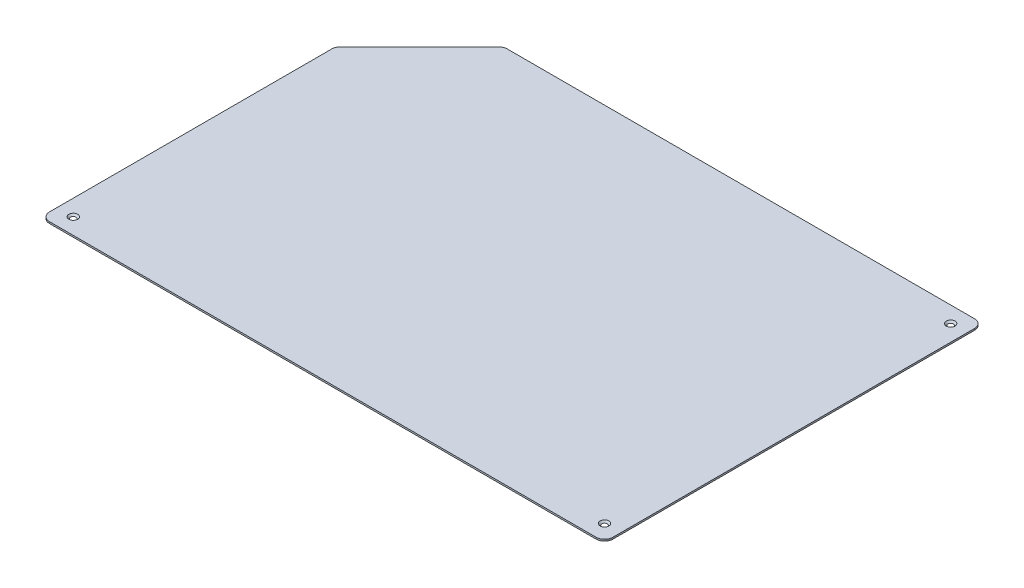
from build123d import *

# Parameters (mm, degrees)
SKETCH1_W                                      = 70
SKETCH1_H                                      = 450.00000000000006
SKETCH1_W_2                                    = 600
BOSS_EXTRUDE1_DEPTH                            = 2
CUT_EXTRUDE1_DEPTH                             = 1.5
TAP_DRILL_FOR_M5X0_8_TAP2_D                    = 4.2
CUT_EXTRUDE2_START                             = -20
CUT_EXTRUDE2_DEPTH                             = 410
BOSS_EXTRUDE2_START                            = -1.500004
BOSS_EXTRUDE2_DEPTH                            = 1.500004
CUT_EXTRUDE3_REACH                             = 624.117
SKETCH13_W                                     = 3.999999999999943
SKETCH13_H                                     = 1.5
CUT_EXTRUDE4_START                             = -1.500012
CUT_EXTRUDE4_DEPTH                             = 1.500012
FILLET1_R                                      = 10
CUT_EXTRUDE5_DEPTH                             = 434.0461869135901
FILLET2_R                                      = 10
CSK_FOR_M5_FLAT_HEAD_MACHINE_SCREW1_AT_2_COUNT = 2
CSK_FOR_M5_FLAT_HEAD_MACHINE_SCREW1_AT_2_PITCH = 411.61522368914996
CSK_FOR_M5_FLAT_HEAD_MACHINE_SCREW1_AT_3_COUNT = 2
CSK_FOR_M5_FLAT_HEAD_MACHINE_SCREW1_AT_3_PITCH = 753.8997832394989


with BuildPart() as part:
    # Sketch1 → Boss-Extrude1 (new body)
    with BuildSketch(Plane(origin=(0, 0, 0), x_dir=(1, 0, 0), z_dir=(0, 1, 0))):
        with Locations((-335, 0)):
            Rectangle(SKETCH1_W, SKETCH1_H)
        Rectangle(SKETCH1_W_2, SKETCH1_H)
    extrude(amount=BOSS_EXTRUDE1_DEPTH)

    # Sketch6 → Cut-Extrude1 (cut)
    with BuildSketch(Plane(origin=(0, 2, 0), x_dir=(1, 0, 0), z_dir=(0, 1, 0))):
        with BuildLine():
            Line((-341.0606607198741, 198.88908788608498), (-332.72792341334934, 190.55635017763316))
            ThreePointArc((-332.72792341334934, 190.55635017763316), (-314.6907946153867, 184.41974360061323), (-298.8274716885969, 194.97203914593416))
            ThreePointArc((-298.8274716885969, 194.97203914593416), (-290.8614378179462, 202.90529640578592), (-280, 205.8076118445749))
            Line((-280, 205.8076118445749), (-280, 201.80761184457492))
            ThreePointArc((-280, 201.80761184457492), (-288.8662005611003, 199.43844938163073), (-295.368880515407, 192.9625250014872))
            ThreePointArc((-295.368880515407, 192.9625250014872), (-314.17414071780195, 180.4532503445859), (-335.5563506063097, 187.7279231211012))
            Line((-335.5563506063097, 187.7279231211012), (-343.8890879128344, 196.06066082955292))
            ThreePointArc((-343.8890879128344, 196.06066082955292), (-343.8890878446203, 198.88908795429913), (-341.0606607198741, 198.88908788608498))
        make_face()
    extrude(amount=-CUT_EXTRUDE1_DEPTH, mode=Mode.SUBTRACT)

    # Tap Drill for M5x0.8 Tap2 (through all)
    with Locations(Plane(origin=(-350.807611845, 2, 205.807611845), x_dir=(0, 0, 1), z_dir=(0, 1, 0))):
        with Locations((0, 0), (-411.61522369, 0), (-411.615222525, 33.33094967), (-378.284274463, 0), (-411.61522369, 631.61522369), (0, 631.61522369)):
            Hole(TAP_DRILL_FOR_M5X0_8_TAP2_D / 2)

    # Sketch11 → Cut-Extrude2 (cut)
    with BuildSketch(Plane.XY.offset(225.00000000000003).offset(CUT_EXTRUDE2_START)):
        with BuildLine():
            Line((-280, 2), (-280, 1.4999999999999996))
            ThreePointArc((-280, 1.4999999999999996), (-279, 0.4999999999999998), (-278, 1.5))
            Line((-278, 1.5), (-278, 2))
            Line((-278, 2), (-280, 2))
        make_face()
        with BuildLine():
            Line((-270, 2), (-270, 1.4999999999999996))
            ThreePointArc((-270, 1.4999999999999996), (-269, 0.4999999999999998), (-268, 1.5))
            Line((-268, 1.5), (-268, 2))
            Line((-268, 2), (-270, 2))
        make_face()
        with BuildLine():
            Line((-260, 2), (-260, 1.4999999999999996))
            ThreePointArc((-260, 1.4999999999999996), (-259, 0.4999999999999998), (-258, 1.5))
            Line((-258, 1.5), (-258, 2))
            Line((-258, 2), (-260, 2))
        make_face()
        with BuildLine():
            Line((-250, 2), (-250, 1.4999999999999996))
            ThreePointArc((-250, 1.4999999999999996), (-249, 0.4999999999999998), (-248, 1.5))
            Line((-248, 1.5), (-248, 2))
            Line((-248, 2), (-250, 2))
        make_face()
        with BuildLine():
            Line((-240, 2), (-240, 1.4999999999999996))
            ThreePointArc((-240, 1.4999999999999996), (-239, 0.4999999999999998), (-238, 1.5))
            Line((-238, 1.5), (-238, 2))
            Line((-238, 2), (-240, 2))
        make_face()
        with BuildLine():
            Line((-229.99999999999997, 2), (-229.99999999999997, 1.4999999999999996))
            ThreePointArc((-229.99999999999997, 1.4999999999999996), (-228.99999999999997, 0.4999999999999998), (-227.99999999999997, 1.5))
            Line((-227.99999999999997, 1.5), (-227.99999999999997, 2))
            Line((-227.99999999999997, 2), (-229.99999999999997, 2))
        make_face()
        with BuildLine():
            Line((-219.99999999999997, 2), (-219.99999999999997, 1.4999999999999996))
            ThreePointArc((-219.99999999999997, 1.4999999999999996), (-218.99999999999997, 0.4999999999999998), (-217.99999999999997, 1.5))
            Line((-217.99999999999997, 1.5), (-217.99999999999997, 2))
            Line((-217.99999999999997, 2), (-219.99999999999997, 2))
        make_face()
        with BuildLine():
            Line((-209.99999999999997, 2), (-209.99999999999997, 1.4999999999999996))
            ThreePointArc((-209.99999999999997, 1.4999999999999996), (-208.99999999999997, 0.4999999999999998), (-207.99999999999997, 1.5))
            Line((-207.99999999999997, 1.5), (-207.99999999999997, 2))
            Line((-207.99999999999997, 2), (-209.99999999999997, 2))
        make_face()
        with BuildLine():
            Line((-199.99999999999994, 2), (-199.99999999999994, 1.4999999999999996))
            ThreePointArc((-199.99999999999994, 1.4999999999999996), (-198.99999999999994, 0.4999999999999998), (-197.99999999999994, 1.5))
            Line((-197.99999999999994, 1.5), (-197.99999999999994, 2))
            Line((-197.99999999999994, 2), (-199.99999999999994, 2))
        make_face()
        with BuildLine():
            Line((-189.99999999999994, 2), (-189.99999999999994, 1.4999999999999996))
            ThreePointArc((-189.99999999999994, 1.4999999999999996), (-188.99999999999994, 0.4999999999999998), (-187.99999999999994, 1.5))
            Line((-187.99999999999994, 1.5), (-187.99999999999994, 2))
            Line((-187.99999999999994, 2), (-189.99999999999994, 2))
        make_face()
        with BuildLine():
            Line((-179.99999999999994, 2), (-179.99999999999994, 1.4999999999999996))
            ThreePointArc((-179.99999999999994, 1.4999999999999996), (-178.99999999999994, 0.4999999999999998), (-177.99999999999994, 1.5))
            Line((-177.99999999999994, 1.5), (-177.99999999999994, 2))
            Line((-177.99999999999994, 2), (-179.99999999999994, 2))
        make_face()
        with BuildLine():
            Line((-169.99999999999994, 2), (-169.99999999999994, 1.4999999999999996))
            ThreePointArc((-169.99999999999994, 1.4999999999999996), (-168.99999999999991, 0.49999999999997136), (-167.99999999999991, 1.5))
            Line((-167.99999999999991, 1.5), (-167.99999999999991, 2))
            Line((-167.99999999999991, 2), (-169.99999999999994, 2))
        make_face()
        with BuildLine():
            Line((-159.99999999999991, 2), (-159.99999999999991, 1.4999999999999996))
            ThreePointArc((-159.99999999999991, 1.4999999999999996), (-158.99999999999991, 0.4999999999999998), (-157.99999999999991, 1.5))
            Line((-157.99999999999991, 1.5), (-157.99999999999991, 2))
            Line((-157.99999999999991, 2), (-159.99999999999991, 2))
        make_face()
        with BuildLine():
            Line((-149.99999999999991, 2), (-149.99999999999991, 1.4999999999999996))
            ThreePointArc((-149.99999999999991, 1.4999999999999996), (-148.99999999999991, 0.4999999999999998), (-147.99999999999991, 1.5))
            Line((-147.99999999999991, 1.5), (-147.99999999999991, 2))
            Line((-147.99999999999991, 2), (-149.99999999999991, 2))
        make_face()
        with BuildLine():
            Line((-139.99999999999991, 2), (-139.99999999999991, 1.4999999999999996))
            ThreePointArc((-139.99999999999991, 1.4999999999999996), (-138.99999999999991, 0.4999999999999998), (-137.9999999999999, 1.5))
            Line((-137.9999999999999, 1.5), (-137.9999999999999, 2))
            Line((-137.9999999999999, 2), (-139.99999999999991, 2))
        make_face()
        with BuildLine():
            Line((-129.9999999999999, 2), (-129.9999999999999, 1.4999999999999996))
            ThreePointArc((-129.9999999999999, 1.4999999999999996), (-128.9999999999999, 0.4999999999999998), (-127.99999999999989, 1.5))
            Line((-127.99999999999989, 1.5), (-127.99999999999989, 2))
            Line((-127.99999999999989, 2), (-129.9999999999999, 2))
        make_face()
        with BuildLine():
            Line((-119.99999999999989, 2), (-119.99999999999989, 1.4999999999999996))
            ThreePointArc((-119.99999999999989, 1.4999999999999996), (-118.99999999999989, 0.4999999999999998), (-117.99999999999989, 1.5))
            Line((-117.99999999999989, 1.5), (-117.99999999999989, 2))
            Line((-117.99999999999989, 2), (-119.99999999999989, 2))
        make_face()
        with BuildLine():
            Line((-109.99999999999987, 2), (-109.99999999999987, 1.4999999999999996))
            ThreePointArc((-109.99999999999987, 1.4999999999999996), (-108.99999999999987, 0.4999999999999998), (-107.99999999999987, 1.5))
            Line((-107.99999999999987, 1.5), (-107.99999999999987, 2))
            Line((-107.99999999999987, 2), (-109.99999999999987, 2))
        make_face()
        with BuildLine():
            Line((-99.99999999999987, 2), (-99.99999999999987, 1.4999999999999996))
            ThreePointArc((-99.99999999999987, 1.4999999999999996), (-98.99999999999987, 0.4999999999999998), (-97.99999999999986, 1.5))
            Line((-97.99999999999986, 1.5), (-97.99999999999986, 2))
            Line((-97.99999999999986, 2), (-99.99999999999987, 2))
        make_face()
        with BuildLine():
            Line((-89.99999999999986, 2), (-89.99999999999986, 1.4999999999999996))
            ThreePointArc((-89.99999999999986, 1.4999999999999996), (-88.99999999999986, 0.4999999999999998), (-87.99999999999986, 1.5))
            Line((-87.99999999999986, 1.5), (-87.99999999999986, 2))
            Line((-87.99999999999986, 2), (-89.99999999999986, 2))
        make_face()
        with BuildLine():
            Line((-79.99999999999984, 2), (-79.99999999999984, 1.4999999999999996))
            ThreePointArc((-79.99999999999984, 1.4999999999999996), (-78.99999999999984, 0.4999999999999998), (-77.99999999999984, 1.5))
            Line((-77.99999999999984, 1.5), (-77.99999999999984, 2))
            Line((-77.99999999999984, 2), (-79.99999999999984, 2))
        make_face()
        with BuildLine():
            Line((-69.99999999999984, 2), (-69.99999999999984, 1.4999999999999996))
            ThreePointArc((-69.99999999999984, 1.4999999999999996), (-68.99999999999984, 0.4999999999999998), (-67.99999999999984, 1.5))
            Line((-67.99999999999984, 1.5), (-67.99999999999984, 2))
            Line((-67.99999999999984, 2), (-69.99999999999984, 2))
        make_face()
        with BuildLine():
            Line((-59.99999999999983, 2), (-59.99999999999983, 1.4999999999999996))
            ThreePointArc((-59.99999999999983, 1.4999999999999996), (-58.99999999999983, 0.4999999999999998), (-57.99999999999983, 1.5))
            Line((-57.99999999999983, 1.5), (-57.99999999999983, 2))
            Line((-57.99999999999983, 2), (-59.99999999999983, 2))
        make_face()
        with BuildLine():
            Line((-49.99999999999982, 2), (-49.99999999999982, 1.4999999999999996))
            ThreePointArc((-49.99999999999982, 1.4999999999999996), (-48.99999999999982, 0.4999999999999998), (-47.99999999999982, 1.5))
            Line((-47.99999999999982, 1.5), (-47.99999999999982, 2))
            Line((-47.99999999999982, 2), (-49.99999999999982, 2))
        make_face()
        with BuildLine():
            Line((-39.999999999999815, 2), (-39.999999999999815, 1.4999999999999996))
            ThreePointArc((-39.999999999999815, 1.4999999999999996), (-38.999999999999815, 0.4999999999999998), (-37.999999999999815, 1.5))
            Line((-37.999999999999815, 1.5), (-37.999999999999815, 2))
            Line((-37.999999999999815, 2), (-39.999999999999815, 2))
        make_face()
        with BuildLine():
            Line((-29.999999999999805, 2), (-29.999999999999805, 1.4999999999999996))
            ThreePointArc((-29.999999999999805, 1.4999999999999996), (-28.999999999999805, 0.4999999999999998), (-27.9999999999998, 1.5))
            Line((-27.9999999999998, 1.5), (-27.9999999999998, 2))
            Line((-27.9999999999998, 2), (-29.999999999999805, 2))
        make_face()
        with BuildLine():
            Line((-19.999999999999794, 2), (-19.999999999999794, 1.4999999999999996))
            ThreePointArc((-19.999999999999794, 1.4999999999999996), (-18.999999999999794, 0.4999999999999998), (-17.999999999999794, 1.5))
            Line((-17.999999999999794, 1.5), (-17.999999999999794, 2))
            Line((-17.999999999999794, 2), (-19.999999999999794, 2))
        make_face()
        with BuildLine():
            Line((-9.999999999999787, 2), (-9.999999999999787, 1.4999999999999996))
            ThreePointArc((-9.999999999999787, 1.4999999999999996), (-8.999999999999787, 0.4999999999999998), (-7.999999999999785, 1.5))
            Line((-7.999999999999785, 1.5), (-7.999999999999785, 2))
            Line((-7.999999999999785, 2), (-9.999999999999787, 2))
        make_face()
        with BuildLine():
            Line((2.2204e-13, 2), (2.2204e-13, 1.4999999999999996))
            ThreePointArc((2.2204e-13, 1.4999999999999996), (1.000000000000223, 0.4999999999999989), (2.000000000000224, 1.5))
            Line((2.000000000000224, 1.5), (2.000000000000224, 2))
            Line((2.000000000000224, 2), (2.2204e-13, 2))
        make_face()
        with BuildLine():
            Line((10.000000000000231, 2), (10.000000000000231, 1.4999999999999996))
            ThreePointArc((10.000000000000231, 1.4999999999999996), (11.000000000000231, 0.4999999999999998), (12.000000000000233, 1.5))
            Line((12.000000000000233, 1.5), (12.000000000000233, 2))
            Line((12.000000000000233, 2), (10.000000000000231, 2))
        make_face()
        with BuildLine():
            Line((20.00000000000024, 2), (20.00000000000024, 1.4999999999999996))
            ThreePointArc((20.00000000000024, 1.4999999999999996), (21.00000000000024, 0.4999999999999998), (22.00000000000024, 1.5))
            Line((22.00000000000024, 1.5), (22.00000000000024, 2))
            Line((22.00000000000024, 2), (20.00000000000024, 2))
        make_face()
        with BuildLine():
            Line((30.00000000000025, 2), (30.00000000000025, 1.4999999999999996))
            ThreePointArc((30.00000000000025, 1.4999999999999996), (31.00000000000025, 0.4999999999999998), (32.00000000000025, 1.5))
            Line((32.00000000000025, 1.5), (32.00000000000025, 2))
            Line((32.00000000000025, 2), (30.00000000000025, 2))
        make_face()
        with BuildLine():
            Line((40.000000000000256, 2), (40.000000000000256, 1.4999999999999996))
            ThreePointArc((40.000000000000256, 1.4999999999999996), (41.000000000000256, 0.4999999999999998), (42.000000000000256, 1.5))
            Line((42.000000000000256, 1.5), (42.000000000000256, 2))
            Line((42.000000000000256, 2), (40.000000000000256, 2))
        make_face()
        with BuildLine():
            Line((50.00000000000027, 2), (50.00000000000027, 1.4999999999999996))
            ThreePointArc((50.00000000000027, 1.4999999999999996), (51.00000000000027, 0.4999999999999998), (52.00000000000027, 1.5))
            Line((52.00000000000027, 1.5), (52.00000000000027, 2))
            Line((52.00000000000027, 2), (50.00000000000027, 2))
        make_face()
        with BuildLine():
            Line((60.00000000000028, 2), (60.00000000000028, 1.4999999999999996))
            ThreePointArc((60.00000000000028, 1.4999999999999996), (61.00000000000028, 0.4999999999999998), (62.00000000000028, 1.5))
            Line((62.00000000000028, 1.5), (62.00000000000028, 2))
            Line((62.00000000000028, 2), (60.00000000000028, 2))
        make_face()
        with BuildLine():
            Line((70.00000000000028, 2), (70.00000000000028, 1.4999999999999996))
            ThreePointArc((70.00000000000028, 1.4999999999999996), (71.00000000000028, 0.4999999999999998), (72.00000000000028, 1.5))
            Line((72.00000000000028, 1.5), (72.00000000000028, 2))
            Line((72.00000000000028, 2), (70.00000000000028, 2))
        make_face()
        with BuildLine():
            Line((80.0000000000003, 2), (80.0000000000003, 1.4999999999999996))
            ThreePointArc((80.0000000000003, 1.4999999999999996), (81.0000000000003, 0.4999999999999998), (82.0000000000003, 1.5))
            Line((82.0000000000003, 1.5), (82.0000000000003, 2))
            Line((82.0000000000003, 2), (80.0000000000003, 2))
        make_face()
        with BuildLine():
            Line((90.0000000000003, 2), (90.0000000000003, 1.4999999999999996))
            ThreePointArc((90.0000000000003, 1.4999999999999996), (91.0000000000003, 0.4999999999999998), (92.0000000000003, 1.5))
            Line((92.0000000000003, 1.5), (92.0000000000003, 2))
            Line((92.0000000000003, 2), (90.0000000000003, 2))
        make_face()
        with BuildLine():
            Line((100.00000000000031, 2), (100.00000000000031, 1.4999999999999996))
            ThreePointArc((100.00000000000031, 1.4999999999999996), (101.00000000000031, 0.4999999999999998), (102.00000000000031, 1.5))
            Line((102.00000000000031, 1.5), (102.00000000000031, 2))
            Line((102.00000000000031, 2), (100.00000000000031, 2))
        make_face()
        with BuildLine():
            Line((110.00000000000031, 2), (110.00000000000031, 1.4999999999999996))
            ThreePointArc((110.00000000000031, 1.4999999999999996), (111.00000000000033, 0.49999999999998557), (112.00000000000033, 1.5))
            Line((112.00000000000033, 1.5), (112.00000000000033, 2))
            Line((112.00000000000033, 2), (110.00000000000031, 2))
        make_face()
        with BuildLine():
            Line((120.00000000000033, 2), (120.00000000000033, 1.4999999999999996))
            ThreePointArc((120.00000000000033, 1.4999999999999996), (121.00000000000033, 0.4999999999999998), (122.00000000000033, 1.5))
            Line((122.00000000000033, 1.5), (122.00000000000033, 2))
            Line((122.00000000000033, 2), (120.00000000000033, 2))
        make_face()
        with BuildLine():
            Line((130.00000000000034, 2), (130.00000000000034, 1.4999999999999996))
            ThreePointArc((130.00000000000034, 1.4999999999999996), (131.00000000000034, 0.4999999999999998), (132.00000000000034, 1.5))
            Line((132.00000000000034, 1.5), (132.00000000000034, 2))
            Line((132.00000000000034, 2), (130.00000000000034, 2))
        make_face()
        with BuildLine():
            Line((140.00000000000034, 2), (140.00000000000034, 1.4999999999999996))
            ThreePointArc((140.00000000000034, 1.4999999999999996), (141.00000000000034, 0.4999999999999998), (142.00000000000034, 1.5))
            Line((142.00000000000034, 1.5), (142.00000000000034, 2))
            Line((142.00000000000034, 2), (140.00000000000034, 2))
        make_face()
        with BuildLine():
            Line((150.00000000000034, 2), (150.00000000000034, 1.4999999999999996))
            ThreePointArc((150.00000000000034, 1.4999999999999996), (151.00000000000037, 0.49999999999997136), (152.00000000000037, 1.5))
            Line((152.00000000000037, 1.5), (152.00000000000037, 2))
            Line((152.00000000000037, 2), (150.00000000000034, 2))
        make_face()
        with BuildLine():
            Line((160.00000000000037, 2), (160.00000000000037, 1.4999999999999996))
            ThreePointArc((160.00000000000037, 1.4999999999999996), (161.00000000000037, 0.4999999999999998), (162.00000000000037, 1.5))
            Line((162.00000000000037, 1.5), (162.00000000000037, 2))
            Line((162.00000000000037, 2), (160.00000000000037, 2))
        make_face()
        with BuildLine():
            Line((170.00000000000037, 2), (170.00000000000037, 1.4999999999999996))
            ThreePointArc((170.00000000000037, 1.4999999999999996), (171.00000000000037, 0.4999999999999998), (172.00000000000037, 1.5))
            Line((172.00000000000037, 1.5), (172.00000000000037, 2))
            Line((172.00000000000037, 2), (170.00000000000037, 2))
        make_face()
        with BuildLine():
            Line((180.00000000000037, 2), (180.00000000000037, 1.4999999999999996))
            ThreePointArc((180.00000000000037, 1.4999999999999996), (181.00000000000037, 0.4999999999999998), (182.0000000000004, 1.5))
            Line((182.0000000000004, 1.5), (182.0000000000004, 2))
            Line((182.0000000000004, 2), (180.00000000000037, 2))
        make_face()
        with BuildLine():
            Line((190.0000000000004, 2), (190.0000000000004, 1.4999999999999996))
            ThreePointArc((190.0000000000004, 1.4999999999999996), (191.0000000000004, 0.4999999999999998), (192.0000000000004, 1.5))
            Line((192.0000000000004, 1.5), (192.0000000000004, 2))
            Line((192.0000000000004, 2), (190.0000000000004, 2))
        make_face()
        with BuildLine():
            Line((200.0000000000004, 2), (200.0000000000004, 1.4999999999999996))
            ThreePointArc((200.0000000000004, 1.4999999999999996), (201.0000000000004, 0.4999999999999998), (202.0000000000004, 1.5))
            Line((202.0000000000004, 1.5), (202.0000000000004, 2))
            Line((202.0000000000004, 2), (200.0000000000004, 2))
        make_face()
        with BuildLine():
            Line((210.0000000000004, 2), (210.0000000000004, 1.4999999999999996))
            ThreePointArc((210.0000000000004, 1.4999999999999996), (211.0000000000004, 0.4999999999999998), (212.0000000000004, 1.5))
            Line((212.0000000000004, 1.5), (212.0000000000004, 2))
            Line((212.0000000000004, 2), (210.0000000000004, 2))
        make_face()
        with BuildLine():
            Line((220.00000000000043, 2), (220.00000000000043, 1.4999999999999996))
            ThreePointArc((220.00000000000043, 1.4999999999999996), (221.00000000000043, 0.4999999999999998), (222.00000000000043, 1.5))
            Line((222.00000000000043, 1.5), (222.00000000000043, 2))
            Line((222.00000000000043, 2), (220.00000000000043, 2))
        make_face()
        with BuildLine():
            Line((230.00000000000043, 2), (230.00000000000043, 1.4999999999999996))
            ThreePointArc((230.00000000000043, 1.4999999999999996), (231.00000000000043, 0.4999999999999998), (232.00000000000043, 1.5))
            Line((232.00000000000043, 1.5), (232.00000000000043, 2))
            Line((232.00000000000043, 2), (230.00000000000043, 2))
        make_face()
        with BuildLine():
            Line((240.00000000000043, 2), (240.00000000000043, 1.4999999999999996))
            ThreePointArc((240.00000000000043, 1.4999999999999996), (241.00000000000043, 0.4999999999999998), (242.00000000000043, 1.5))
            Line((242.00000000000043, 1.5), (242.00000000000043, 2))
            Line((242.00000000000043, 2), (240.00000000000043, 2))
        make_face()
        with BuildLine():
            Line((250.00000000000045, 2), (250.00000000000045, 1.4999999999999996))
            ThreePointArc((250.00000000000045, 1.4999999999999996), (251.00000000000045, 0.4999999999999998), (252.00000000000045, 1.5))
            Line((252.00000000000045, 1.5), (252.00000000000045, 2))
            Line((252.00000000000045, 2), (250.00000000000045, 2))
        make_face()
        with BuildLine():
            Line((260.00000000000045, 2), (260.00000000000045, 1.4999999999999996))
            ThreePointArc((260.00000000000045, 1.4999999999999996), (261.00000000000045, 0.4999999999999998), (262.00000000000045, 1.5))
            Line((262.00000000000045, 1.5), (262.00000000000045, 2))
            Line((262.00000000000045, 2), (260.00000000000045, 2))
        make_face()
        with BuildLine():
            Line((270.00000000000045, 2), (270.00000000000045, 1.4999999999999996))
            ThreePointArc((270.00000000000045, 1.4999999999999996), (271.00000000000045, 0.4999999999999998), (272.00000000000045, 1.5))
            Line((272.00000000000045, 1.5), (272.00000000000045, 2))
            Line((272.00000000000045, 2), (270.00000000000045, 2))
        make_face()
        with BuildLine():
            Line((-290.00000000000006, 1.9999999999999303), (-290.00000000000006, 1.4999999999999298))
            ThreePointArc((-290.00000000000006, 1.4999999999999298), (-289.00000000000006, 0.49999999999993006), (-288.00000000000006, 1.4999999999999303))
            Line((-288.00000000000006, 1.4999999999999303), (-288.00000000000006, 1.9999999999999303))
            Line((-288.00000000000006, 1.9999999999999303), (-290.00000000000006, 1.9999999999999303))
        make_face()
        with BuildLine():
            Line((-300.00000000000006, 1.9999999999998603), (-300.00000000000006, 1.49999999999986))
            ThreePointArc((-300.00000000000006, 1.49999999999986), (-299.00000000000006, 0.4999999999998601), (-298.00000000000006, 1.4999999999998603))
            Line((-298.00000000000006, 1.4999999999998603), (-298.00000000000006, 1.9999999999998603))
            Line((-298.00000000000006, 1.9999999999998603), (-300.00000000000006, 1.9999999999998603))
        make_face()
        with BuildLine():
            Line((-310.00000000000006, 1.9999999999997906), (-310.00000000000006, 1.4999999999997902))
            ThreePointArc((-310.00000000000006, 1.4999999999997902), (-309.00000000000006, 0.4999999999997904), (-308.00000000000006, 1.4999999999997906))
            Line((-308.00000000000006, 1.4999999999997906), (-308.00000000000006, 1.9999999999997906))
            Line((-308.00000000000006, 1.9999999999997906), (-310.00000000000006, 1.9999999999997906))
        make_face()
        with BuildLine():
            Line((-320.00000000000006, 1.9999999999997207), (-320.00000000000006, 1.4999999999997202))
            ThreePointArc((-320.00000000000006, 1.4999999999997202), (-319.00000000000006, 0.49999999999972045), (-318.00000000000006, 1.4999999999997207))
            Line((-318.00000000000006, 1.4999999999997207), (-318.00000000000006, 1.9999999999997207))
            Line((-318.00000000000006, 1.9999999999997207), (-320.00000000000006, 1.9999999999997207))
        make_face()
        with BuildLine():
            Line((-330.00000000000006, 1.999999999999651), (-330.00000000000006, 1.4999999999996505))
            ThreePointArc((-330.00000000000006, 1.4999999999996505), (-329.00000000000006, 0.4999999999996507), (-328.00000000000006, 1.499999999999651))
            Line((-328.00000000000006, 1.499999999999651), (-328.00000000000006, 1.999999999999651))
            Line((-328.00000000000006, 1.999999999999651), (-330.00000000000006, 1.999999999999651))
        make_face()
        with BuildLine():
            Line((-340.00000000000006, 1.999999999999581), (-340.00000000000006, 1.4999999999995806))
            ThreePointArc((-340.00000000000006, 1.4999999999995806), (-339.00000000000006, 0.4999999999995808), (-338.00000000000006, 1.499999999999581))
            Line((-338.00000000000006, 1.499999999999581), (-338.00000000000006, 1.999999999999581))
            Line((-338.00000000000006, 1.999999999999581), (-340.00000000000006, 1.999999999999581))
        make_face()
    extrude(amount=-CUT_EXTRUDE2_DEPTH, mode=Mode.SUBTRACT)

    # Sketch12 → Boss-Extrude2 (add)
    with BuildSketch(Plane(origin=(0, 2, 0), x_dir=(1, 0, 0), z_dir=(0, 1, 0)).offset(BOSS_EXTRUDE2_START)):
        with BuildLine():
            Line((-280, 205.8076118445749), (-315.3766621750845, 205.80761184457492))
            ThreePointArc((-315.3766621750845, 205.80761184457492), (-317.4766621750842, 203.70761068025845), (-319.57666217508387, 205.8076118445749))
            Line((-319.57666217508387, 205.8076118445749), (-347.8076118445748, 205.80761184457492))
            ThreePointArc((-347.8076118445748, 205.80761184457492), (-348.68629150101515, 203.6862915010153), (-350.8076118445748, 202.80761184457492))
            Line((-350.8076118445748, 202.80761184457492), (-350.8076118445748, 177.42283645946387))
            ThreePointArc((-350.8076118445748, 177.42283645946387), (-348.1152238035296, 183.9228359616302), (-341.6152241714967, 186.61522368914976))
            ThreePointArc((-341.6152241714967, 186.61522368914976), (-340.80494778100666, 186.64810510087744), (-340, 186.74653317652297))
            Line((-340, 186.74653317652297), (-340, 192.17157272912957))
            Line((-340, 192.17157272912957), (-343.8890879128344, 196.06066082955292))
            ThreePointArc((-343.8890879128344, 196.06066082955292), (-343.8890878446203, 198.88908795429913), (-341.0606607198741, 198.88908788608498))
            Line((-341.0606607198741, 198.88908788608498), (-339.00000000000006, 196.82842706681566))
            Line((-339.00000000000006, 196.82842706681566), (-332.72792341334934, 190.55635017763316))
            ThreePointArc((-332.72792341334934, 190.55635017763316), (-330.94667886073466, 188.9624165061017), (-329.00000000000006, 187.57536996087322))
            ThreePointArc((-329.00000000000006, 187.57536996087322), (-324.20329094233676, 185.3148221510144), (-319.00000000000006, 184.29293294277124))
            ThreePointArc((-319.00000000000006, 184.29293294277124), (-313.8997661604346, 184.53773218560949), (-309.00000000000006, 185.97460499160286))
            ThreePointArc((-309.00000000000006, 185.97460499160286), (-303.3144543819765, 189.5400421249523), (-299.00000000000006, 194.68039759051484))
            ThreePointArc((-299.00000000000006, 194.68039759051484), (-298.9131631067138, 194.82587955008788), (-298.8274716885969, 194.97203914593416))
            ThreePointArc((-298.8274716885969, 194.97203914593416), (-294.6062905919319, 200.1820345928733), (-289.00000000000006, 203.86061151972768))
            ThreePointArc((-289.00000000000006, 203.86061151972768), (-284.6040962811652, 205.31529626056675), (-280, 205.8076118445749))
        make_face()
        with BuildLine():
            Line((-350.8076118445748, -177.42283645946387), (-350.80761184457475, -203.70761184457504))
            ThreePointArc((-350.80761184457475, -203.70761184457504), (-349.322687604083, -204.32268760408328), (-348.7076118445748, -205.80761184457504))
            Line((-348.7076118445748, -205.80761184457504), (-322.42283601607215, -205.80761091883545))
            ThreePointArc((-322.42283601607215, -205.80761091883545), (-328.9228356481046, -203.11522319131578), (-331.6152236891497, -196.61522368914987))
            ThreePointArc((-331.6152236891497, -196.61522368914987), (-334.5441560478196, -189.5441557067489), (-341.6152241714967, -186.61522368914976))
            ThreePointArc((-341.6152241714967, -186.61522368914976), (-348.1152238035296, -183.9228359616302), (-350.8076118445748, -177.42283645946387))
        make_face()
        with BuildLine():
            Line((278.70761184452584, -205.80761184457504), (252.4228360160232, -205.80761091883545))
            ThreePointArc((252.4228360160232, -205.80761091883545), (258.9228356480558, -203.11522319131592), (261.61522368910096, -196.61522368914987))
            ThreePointArc((261.61522368910096, -196.61522368914987), (264.5441560477708, -189.54415570674908), (271.6152241714478, -186.61522368914987))
            ThreePointArc((271.6152241714478, -186.61522368914987), (278.1152238034807, -183.92283596163023), (280.8076118445259, -177.42283645946387))
            Line((280.8076118445259, -177.42283645946387), (280.80761184452587, -203.70761184457504))
            ThreePointArc((280.80761184452587, -203.70761184457504), (279.3226876040341, -204.32268760408328), (278.70761184452584, -205.80761184457504))
        make_face()
        with BuildLine():
            Line((280.8076118445259, 177.42283645946392), (280.80761184452587, 203.7076118445751))
            ThreePointArc((280.80761184452587, 203.7076118445751), (279.3226876040341, 204.32268760408334), (278.70761184452584, 205.8076118445751))
            Line((278.70761184452584, 205.8076118445751), (252.4228360160232, 205.8076109188355))
            ThreePointArc((252.4228360160232, 205.8076109188355), (258.9228356480558, 203.11522319131598), (261.61522368910096, 196.61522368914993))
            ThreePointArc((261.61522368910096, 196.61522368914993), (264.5441560477708, 189.54415570674914), (271.6152241714478, 186.61522368914993))
            ThreePointArc((271.6152241714478, 186.61522368914993), (278.1152238034807, 183.92283596163028), (280.8076118445259, 177.42283645946392))
        make_face()
    extrude(amount=BOSS_EXTRUDE2_DEPTH)

    # Cut-Extrude3: up to this face of the body (flat: up to its plane)
    cut_extrude3_end = Plane(part.part.faces().sort_by_distance((252, 1.75, 0))[0])
    # Sketch13 → Cut-Extrude3 (cut, up to the picked face)
    with BuildSketch(Plane.ZY.offset(280), mode=Mode.PRIVATE) as cut_extrude3_sk1:
        with Locations((-203.8076118445749, 1.25)):
            Rectangle(SKETCH13_W, SKETCH13_H)
    cut_extrude3_tool1 = split(extrude(cut_extrude3_sk1.sketch, amount=-CUT_EXTRUDE3_REACH, mode=Mode.PRIVATE), bisect_by=cut_extrude3_end, keep=Keep.BOTH, mode=Mode.PRIVATE)
    add(cut_extrude3_tool1.solids().sort_by(Axis((-280, 1.25, -203.807612), (1, 0, 0)))[0], mode=Mode.SUBTRACT)

    # Sketch14 → Cut-Extrude4 (cut)
    with BuildSketch(Plane(origin=(0, 2, 0), x_dir=(1, 0, 0), z_dir=(0, 1, 0)).offset(CUT_EXTRUDE4_START)):
        with BuildLine():
            Line((252.42283601607218, 205.80761091883545), (252.00000000000045, 205.8076118445749))
            Line((252.00000000000045, 205.8076118445749), (252.00000000000045, 201.80761184457492))
            ThreePointArc((252.00000000000045, 201.80761184457492), (255.9539047554501, 200.44552943636293), (257.63241277890234, 196.61522368914976))
            ThreePointArc((257.63241277890234, 196.61522368914976), (261.72788351292104, 186.7278830360081), (271.6152243636065, 182.63241277890236))
            ThreePointArc((271.6152243636065, 182.63241277890236), (271.8077436848893, 182.6288543076604), (272.00000000000045, 182.61818373669826))
            Line((272.00000000000045, 182.61818373669826), (272.00000000000045, 186.60716718540516))
            ThreePointArc((272.00000000000045, 186.60716718540516), (271.8076542533465, 186.6132093471491), (271.6152241714968, 186.6152236891498))
            ThreePointArc((271.6152241714968, 186.6152236891498), (264.54415604781974, 189.5441557067489), (261.61522368914984, 196.6152236891497))
            ThreePointArc((261.61522368914984, 196.6152236891497), (258.9228356481048, 203.11522319131586), (252.42283601607218, 205.80761091883545))
        make_face()
    extrude(amount=CUT_EXTRUDE4_DEPTH, mode=Mode.SUBTRACT)

    # Fillet1
    fillet1_edges = [part.edges().sort_by_distance(p)[0] for p in [
        (300, 1, 225.00000000000003),
        (-370, 1, 225.00000000000003),
        (-370, 1, -225.00000000000003),
        (300, 1, -225.00000000000003),
    ]]
    fillet(fillet1_edges, radius=FILLET1_R)


with BuildPart() as body_2:
    # Mirror1: mirrored copy
    add(part.part.mirror(Plane.ZX))

    # Sketch15 → Cut-Extrude5 (cut, through all)
    with BuildSketch(Plane(origin=(0, 0, 0), x_dir=(1, 0, 0), z_dir=(0, 1, 0))):
        with BuildLine():
            Line((-269.99999999999994, 225.00000000000003), (-370, 125.00000482346934))
            Line((-370, 125.00000482346934), (-370, 215.00000000000003))
            ThreePointArc((-370, 215.00000000000003), (-367.0710678118655, 222.0710678118655), (-360, 225.00000000000003))
            Line((-360, 225.00000000000003), (-269.99999999999994, 225.00000000000003))
        make_face()
    extrude(amount=-CUT_EXTRUDE5_DEPTH, mode=Mode.SUBTRACT)

    # Fillet2
    fillet2_edges = [body_2.edges().sort_by_distance(p)[0] for p in [
        (-269.99999999999994, -1, -225.00000000000003),
        (-370, -1, -125.00000482346934),
    ]]
    fillet(fillet2_edges, radius=FILLET2_R)

    # Sketch19 → CSK for M5 Flat Head Machine Screw1 (revolve, cut)
    with BuildSketch(Plane(origin=(280.8076118445749, 0, -205.80761184457492), x_dir=(0, 0, 1), z_dir=(1, 0, 0))):
        Polygon((0, 0), (-4.9e-16, 1.9999999999999991), (2.7499999999999996, 1.9999999999999991), (2.7499999999999996, 2.45), (5.200000000000001, 0), align=None)
    csk_for_m5_flat_head_machine_screw1 = revolve(axis=Axis((280.8076118445749, 6.349999999999991, -205.80761184457492), (0, -1, 0)), mode=Mode.SUBTRACT)

    # CSK for M5 Flat Head Machine Screw1 at 2: CSK for M5 Flat Head Machine Screw1 ×2
    with Locations(*[(0, 0, i * CSK_FOR_M5_FLAT_HEAD_MACHINE_SCREW1_AT_2_PITCH) for i in range(1, CSK_FOR_M5_FLAT_HEAD_MACHINE_SCREW1_AT_2_COUNT)]):
        add(csk_for_m5_flat_head_machine_screw1, mode=Mode.SUBTRACT)

    # CSK for M5 Flat Head Machine Screw1 at 3: CSK for M5 Flat Head Machine Screw1 ×2
    with Locations(*[Vector(-0.837797327617082, 0, 0.545981353012789) * (i * CSK_FOR_M5_FLAT_HEAD_MACHINE_SCREW1_AT_3_PITCH) for i in range(1, CSK_FOR_M5_FLAT_HEAD_MACHINE_SCREW1_AT_3_COUNT)]):
        add(csk_for_m5_flat_head_machine_screw1, mode=Mode.SUBTRACT)


solid = body_2.part
